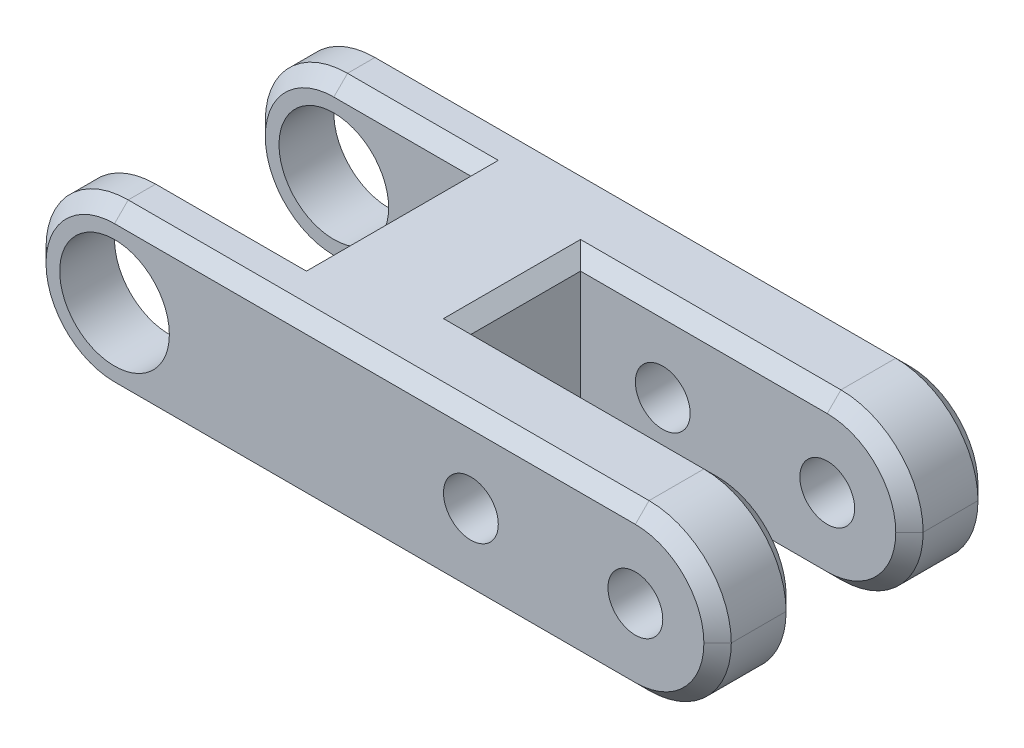
from build123d import *

# Parameters (mm, degrees)
BOSS_EXTRUDE1_DEPTH       = 6
FILLET1_R                 = 3
F_4_0MM_DOWEL_HOLE1_D     = 4
F_4_0MM_DOWEL_HOLE1_DEPTH = 10
F_4_0MM_DOWEL_HOLE1_TIP   = 1.201721238
F_2_0MM_DOWEL_HOLE1_D     = 2
F_2_0MM_DOWEL_HOLE1_DEPTH = 10
F_2_0MM_DOWEL_HOLE1_TIP   = 0.600860619
CHAMFER1_SIZE             = 0.5


with BuildPart() as part:
    # Sketch2 → Boss-Extrude1 (new body)
    with BuildSketch(Plane(origin=(0, 0, 0), x_dir=(1, 0, 0), z_dir=(0, 1, 0))):
        Polygon((0, 3), (0, 5), (25, 5), (25, 2), (13, 2), (13, -2), (25, -2), (25, -5), (0, -5), (0, -3), (8, -3), (8, 3), align=None)
    extrude(amount=BOSS_EXTRUDE1_DEPTH)

    # Fillet1
    fillet1_edges = [part.edges().sort_by_distance(p)[0] for p in [
        (25, 6, -3.5),
        (25, 0, -3.5),
        (25, 0, 3.5),
        (25, 6, 3.5),
        (0, 6, 4),
        (0, 0, 4),
        (0, 0, -4),
        (0, 6, -4),
    ]]
    fillet(fillet1_edges, radius=FILLET1_R - 0.0001)  # a hair under: the kernel refuses the full size

    # Ø4.0mm Dowel Hole1
    with Locations(Plane.XY.offset(5)):
        with Locations((3, 3)):
            Hole(F_4_0MM_DOWEL_HOLE1_D / 2, depth=F_4_0MM_DOWEL_HOLE1_DEPTH)
            with Locations((0, 0, -(F_4_0MM_DOWEL_HOLE1_DEPTH + F_4_0MM_DOWEL_HOLE1_TIP / 2))):  # 118° drill point
                Cone(0, F_4_0MM_DOWEL_HOLE1_D / 2, F_4_0MM_DOWEL_HOLE1_TIP, mode=Mode.SUBTRACT)

    # Ø2.0mm Dowel Hole1
    with Locations(Plane(origin=(16, 3, 5), x_dir=(1, 0, 0), z_dir=(0, 0, 1))):
        with Locations((0, 0), (6, 0)):
            Hole(F_2_0MM_DOWEL_HOLE1_D / 2, depth=F_2_0MM_DOWEL_HOLE1_DEPTH)
            with Locations((0, 0, -(F_2_0MM_DOWEL_HOLE1_DEPTH + F_2_0MM_DOWEL_HOLE1_TIP / 2))):  # 118° drill point
                Cone(0, F_2_0MM_DOWEL_HOLE1_D / 2, F_2_0MM_DOWEL_HOLE1_TIP, mode=Mode.SUBTRACT)

    # Chamfer1
    chamfer1_edges = [part.edges().sort_by_distance(p)[0] for p in [
        (5.49995, 6, 3),
        (17.50005, 0, -2),
        (5.49995, 0, 3),
        (13, 6, 0),
        (5.49995, 6, -3),
        (12.5, 6, 5),
        (17.50005, 6, 2),
        (17.50005, 6, -2),
        (12.5, 6, -5),
        (12.5, 0, -5),
        (0.878650367, 5.121349633, -5),
        (0.878650367, 0.878650367, -5),
        (24.121349633, 0.878650367, -5),
        (24.121349633, 5.121349633, -5),
        (24.121349633, 0.878650367, -2),
        (24.121349633, 5.121349633, -2),
        (5.49995, 0, -3),
        (17.50005, 0, 2),
        (12.5, 0, 5),
        (24.121349633, 5.121349633, 2),
        (24.121349633, 0.878650367, 2),
        (0.878650367, 0.878650367, 5),
        (0.878650367, 5.121349633, 5),
        (24.121349633, 5.121349633, 5),
        (24.121349633, 0.878650367, 5),
        (0.878650367, 0.878650367, 3),
        (0.878650367, 5.121349633, 3),
        (0.878650367, 5.121349633, -3),
        (0.878650367, 0.878650367, -3),
        (8, 6, 0),
    ]]
    chamfer(chamfer1_edges, length=CHAMFER1_SIZE)


solid = part.part
